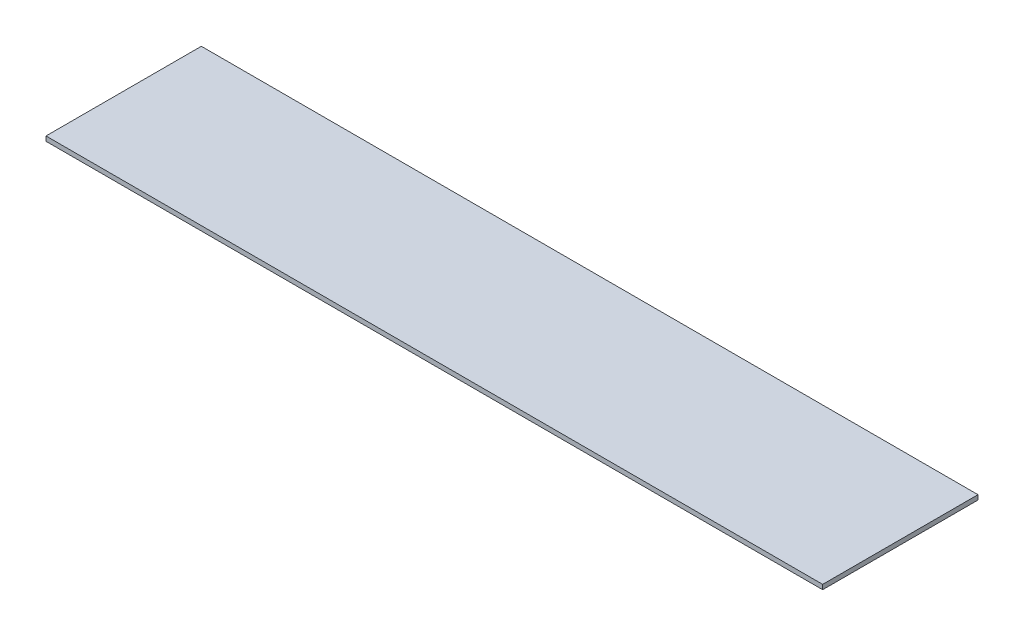
from build123d import *

# Parameters (mm, degrees)
SKETCH1_W           = 125
SKETCH1_H           = 25
BOSS_EXTRUDE1_DEPTH = 0.75


with BuildPart() as part:
    # Sketch1 → Boss-Extrude1 (new body)
    with BuildSketch(Plane(origin=(0, 0, 0), x_dir=(1, 0, 0), z_dir=(0, 1, 0))):
        with Locations((-62.5, 12.5)):
            Rectangle(SKETCH1_W, SKETCH1_H)
    extrude(amount=BOSS_EXTRUDE1_DEPTH)


solid = part.part
